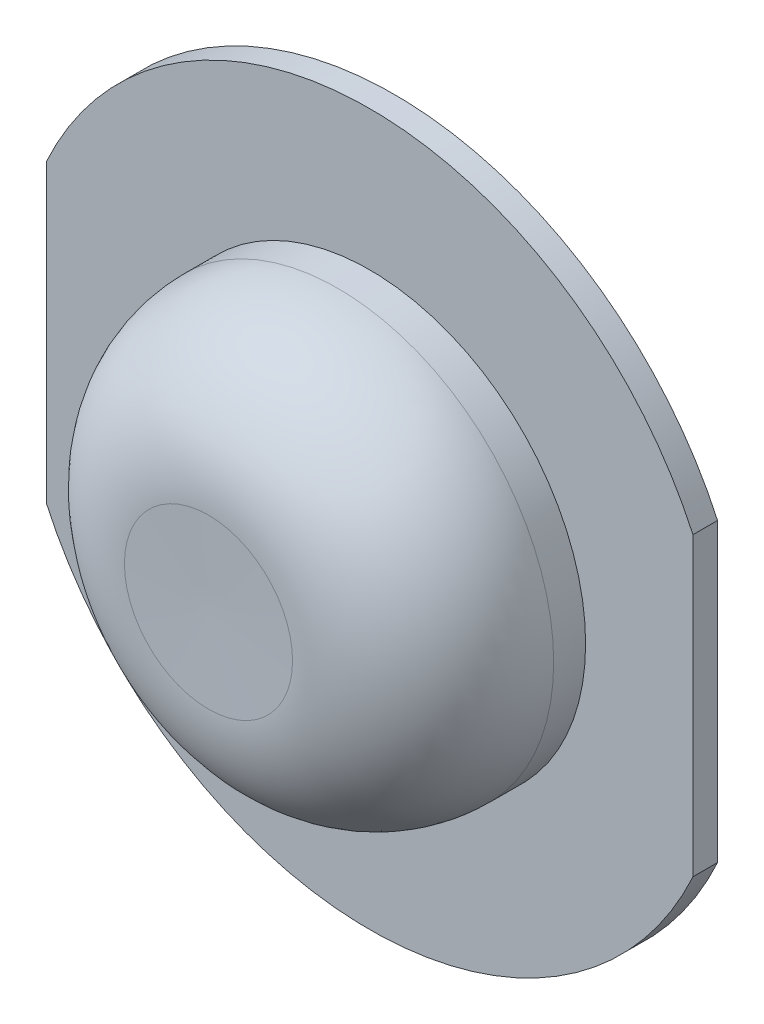
from build123d import *

# Parameters (mm, degrees)
BOSS_EXTRUDE1_DEPTH = 3.8
SKETCH4_W           = 43.3
SKETCH4_H           = 43.3
CUT_EXTRUDE1_DEPTH  = 3


with BuildPart() as part:
    # Sketch1 → Boss-Extrude1 (new body)
    with BuildSketch(Plane.XY):
        with BuildLine():
            Line((50, 22.912878475), (50, -22.912878475))
            ThreePointArc((50, -22.912878475), (0, -55), (-50, -22.912878475))
            Line((-50, -22.912878475), (-50, 22.912878475))
            ThreePointArc((-50, 22.912878475), (0, 55), (50, 22.912878475))
        make_face()
    extrude(amount=BOSS_EXTRUDE1_DEPTH)

    # Sketch4 → Cut-Extrude1 (cut)
    with BuildSketch(Plane(origin=(0, 0, 0), x_dir=(-1, 0, 0), z_dir=(0, 0, -1))):
        Rectangle(SKETCH4_W, SKETCH4_H)
    extrude(amount=-CUT_EXTRUDE1_DEPTH, mode=Mode.SUBTRACT)


with BuildPart() as body_2:
    # Sketch3 → Revolve1 (revolve)
    with BuildSketch(Plane(origin=(0, 0, 0), x_dir=(1, 0, 0), z_dir=(0, 1, 0))):
        with BuildLine():
            Line((0, -3.8), (0, -28.48))
            Line((0, -28.48), (13, -28.736800089))
            ThreePointArc((13, -28.736800089), (27.3967856, -23.021807494), (33.395, -8.740701094))
            Line((33.395, -8.740701094), (33.395, -3.8))
            Line((33.395, -3.8), (0, -3.8))
        make_face()
    revolve(axis=Axis((0, 0, 3.8), (0, 0, 1)))


solid = Compound([part.part, body_2.part])
